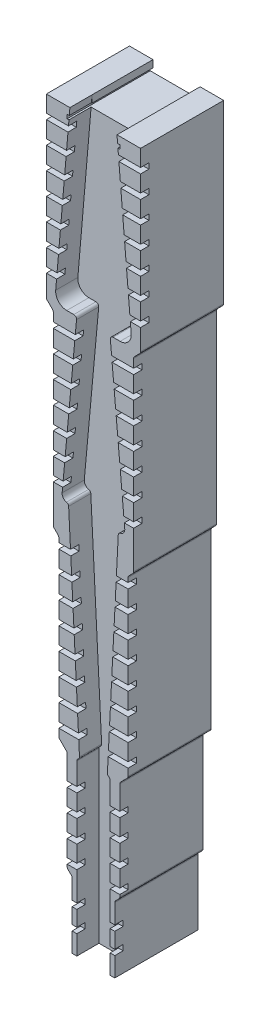
from build123d import *

# Parameters (mm, degrees)
ESQUISSE1_W             = 17
ESQUISSE1_H             = 132
BOSS_EXTRU_1_DEPTH      = 15
ENL_V_MAT_EXTRU_1_DEPTH = 4
CONG_1_R                = 2
CONG_2_R                = 0.5
CONG_3_R                = 1
CONG_4_R                = 0.5
CONG_6_R                = 0.5
CONG_7_R                = 0.5
ENL_V_MAT_EXTRU_2_REACH = 70.215
CONG_8_R                = 0.5
CONG_1_OF_SYM_TRIE2_R   = 2
CONG_2_OF_SYM_TRIE2_R   = 0.5
CONG_3_OF_SYM_TRIE2_R   = 1
CONG_4_OF_SYM_TRIE2_R   = 0.5
CONG_6_OF_SYM_TRIE2_R   = 0.5
CONG_7_OF_SYM_TRIE2_R   = 0.5
CONG_8_OF_SYM_TRIE2_R   = 0.5
CONG_9_R                = 0.5
ESQUISSE5_W             = 0.85
ESQUISSE5_H             = 1
ESQUISSE5_W_2           = 1.75
ESQUISSE5_W_3           = 3.596153846
ESQUISSE5_W_4           = 3.391025641
ESQUISSE5_W_5           = 3.185897436
ESQUISSE5_W_6           = 2.980769231
ESQUISSE5_W_7           = 2.775641026
ESQUISSE5_W_8           = 2.570512821
ESQUISSE5_W_9           = 2.365384615
ESQUISSE5_W_10          = 2.16025641
ESQUISSE5_W_11          = 3.9921875
ESQUISSE5_W_12          = 3.6484375
ESQUISSE5_W_13          = 3.3046875
ESQUISSE5_W_14          = 2.9609375
ESQUISSE5_W_15          = 2.6171875
ESQUISSE5_W_16          = 2.2734375
ESQUISSE5_W_17          = 1.9296875
ESQUISSE5_W_18          = 3.975
ESQUISSE5_W_19          = 3.608333333
ESQUISSE5_W_20          = 3.241666667
ESQUISSE5_W_21          = 2.875
ESQUISSE5_W_22          = 2.508333333
ESQUISSE5_W_23          = 2.141666667
ESQUISSE5_W_24          = 1.775
ENL_V_MAT_EXTRU_3_DEPTH = 1.5
ENL_V_MAT_EXTRU_4_DEPTH = 69.214734597


with BuildPart() as part:
    # Esquisse1 → Boss.-Extru.1 (new body)
    with BuildSketch(Plane.XY):
        Rectangle(ESQUISSE1_W, ESQUISSE1_H)
    extrude(amount=BOSS_EXTRU_1_DEPTH)

    # Esquisse2 → Enlèv. mat.-Extru.1 (cut)
    with BuildSketch(Plane.XY.offset(15)):
        Polygon((0, -66), (0, 66), (4.25, 66), (7, 34), (3, 34), (5.75, 4), (4.5, 4), (2.5, -35), (3, -35), (3, -66), align=None)
    enl_v_mat_extru_1 = extrude(amount=-ENL_V_MAT_EXTRU_1_DEPTH, mode=Mode.SUBTRACT)

    # Congé1
    cong_1_edges = [part.edges().sort_by_distance(p)[0] for p in [
        (7, 34, 13),
    ]]
    fillet(cong_1_edges, radius=CONG_1_R)

    # Congé2
    cong_2_edges = [part.edges().sort_by_distance(p)[0] for p in [
        (3, 34, 13),
    ]]
    fillet(cong_2_edges, radius=CONG_2_R)

    # Congé3
    cong_3_edges = [part.edges().sort_by_distance(p)[0] for p in [
        (5.75, 4, 13),
    ]]
    fillet(cong_3_edges, radius=CONG_3_R)

    # Congé4
    cong_4_edges = [part.edges().sort_by_distance(p)[0] for p in [
        (4.5, 4, 13),
    ]]
    fillet(cong_4_edges, radius=CONG_4_R)

    # Congé6
    cong_6_edges = [part.edges().sort_by_distance(p)[0] for p in [
        (3, -35, 13),
    ]]
    fillet(cong_6_edges, radius=CONG_6_R - 0.0001)  # a hair under: the kernel refuses the full size

    # Congé7
    cong_7_edges = [part.edges().sort_by_distance(p)[0] for p in [
        (2.5, -35, 13),
    ]]
    fillet(cong_7_edges, radius=CONG_7_R)

    # Esquisse4 → Enlèv. mat.-Extru.2 (cut, up to next)
    with BuildSketch(Plane.XY.offset(15), mode=Mode.PRIVATE) as enl_v_mat_extru_2_sk1:
        Polygon((8.5, 34), (7.25, 32.75), (7.25, -1), (6.25, -2), (6.25, -33.5), (4.75, -35), (4.75, -53.1), (3.85, -54), (3.85, -66), (8.5, -66), align=None)
    enl_v_mat_extru_2_tool1 = extrude(enl_v_mat_extru_2_sk1.sketch, amount=-ENL_V_MAT_EXTRU_2_REACH, mode=Mode.PRIVATE) & part.part
    enl_v_mat_extru_2 = enl_v_mat_extru_2_tool1.solids().sort_by_distance((6.965516, -29.327077, 15))[0]
    add(enl_v_mat_extru_2, mode=Mode.SUBTRACT)

    # Congé8
    cong_8_edges = [part.edges().sort_by_distance(p)[0] for p in [
        (3.85, -54, 7.5),
        (4.75, -53.1, 7.5),
        (4.75, -35, 7.5),
        (6.25, -33.5, 7.5),
        (6.25, -2, 7.5),
        (7.25, -1, 7.5),
        (7.25, 32.75, 7.5),
    ]]
    fillet(cong_8_edges, radius=CONG_8_R)

    # Symétrie2: Enlèv. mat.-Extru.1, Enlèv. mat.-Extru.2 across plane
    add(enl_v_mat_extru_1.mirror(Plane(origin=(0, 0, 0), x_dir=(0, 0, 1), z_dir=(1, 0, 0))), mode=Mode.SUBTRACT)
    add(enl_v_mat_extru_2.mirror(Plane(origin=(0, 0, 0), x_dir=(0, 0, 1), z_dir=(1, 0, 0))), mode=Mode.SUBTRACT)

    # Congé1 of Symétrie2
    cong_1_of_sym_trie2_edges = [part.edges().sort_by_distance(p)[0] for p in [
        (-7, 34, 13),
    ]]
    fillet(cong_1_of_sym_trie2_edges, radius=CONG_1_OF_SYM_TRIE2_R)

    # Congé2 of Symétrie2
    cong_2_of_sym_trie2_edges = [part.edges().sort_by_distance(p)[0] for p in [
        (-3, 34, 13),
    ]]
    fillet(cong_2_of_sym_trie2_edges, radius=CONG_2_OF_SYM_TRIE2_R)

    # Congé3 of Symétrie2
    cong_3_of_sym_trie2_edges = [part.edges().sort_by_distance(p)[0] for p in [
        (-5.75, 4, 13),
    ]]
    fillet(cong_3_of_sym_trie2_edges, radius=CONG_3_OF_SYM_TRIE2_R)

    # Congé4 of Symétrie2
    cong_4_of_sym_trie2_edges = [part.edges().sort_by_distance(p)[0] for p in [
        (-4.5, 4, 13),
    ]]
    fillet(cong_4_of_sym_trie2_edges, radius=CONG_4_OF_SYM_TRIE2_R)

    # Congé6 of Symétrie2
    cong_6_of_sym_trie2_edges = [part.edges().sort_by_distance(p)[0] for p in [
        (-3, -35, 13),
    ]]
    fillet(cong_6_of_sym_trie2_edges, radius=CONG_6_OF_SYM_TRIE2_R - 0.0001)  # a hair under: the kernel refuses the full size

    # Congé7 of Symétrie2
    cong_7_of_sym_trie2_edges = [part.edges().sort_by_distance(p)[0] for p in [
        (-2.5, -35, 13),
    ]]
    fillet(cong_7_of_sym_trie2_edges, radius=CONG_7_OF_SYM_TRIE2_R)

    # Congé8 of Symétrie2
    cong_8_of_sym_trie2_edges = [part.edges().sort_by_distance(p)[0] for p in [
        (-3.85, -54, 7.5),
        (-4.75, -53.1, 7.5),
        (-4.75, -35, 7.5),
        (-6.25, -33.5, 7.5),
        (-6.25, -2, 7.5),
        (-7.25, -1, 7.5),
        (-7.25, 32.75, 7.5),
    ]]
    fillet(cong_8_of_sym_trie2_edges, radius=CONG_8_OF_SYM_TRIE2_R)

    # Congé9
    cong_9_edges = [part.edges().sort_by_distance(p)[0] for p in [
        (-8.5, 34, 7.5),
        (8.5, 34, 7.5),
    ]]
    fillet(cong_9_edges, radius=CONG_9_R)

    # Esquisse5 → Enlèv. mat.-Extru.3 (cut)
    with BuildSketch(Plane.XY.offset(15)):
        with Locations((3.425, -62)):
            Rectangle(ESQUISSE5_W, ESQUISSE5_H)
        with Locations((3.425, -58.2)):
            Rectangle(ESQUISSE5_W, ESQUISSE5_H)
        with Locations((3.875, -52)):
            Rectangle(ESQUISSE5_W_2, ESQUISSE5_H)
        with Locations((3.875, -48)):
            Rectangle(ESQUISSE5_W_2, ESQUISSE5_H)
        with Locations((3.875, -44)):
            Rectangle(ESQUISSE5_W_2, ESQUISSE5_H)
        with Locations((3.875, -40)):
            Rectangle(ESQUISSE5_W_2, ESQUISSE5_H)
        with Locations((4.451923077, -31.5)):
            Rectangle(ESQUISSE5_W_3, ESQUISSE5_H)
        with Locations((4.55448718, -27.5)):
            Rectangle(ESQUISSE5_W_4, ESQUISSE5_H)
        with Locations((4.657051282, -23.5)):
            Rectangle(ESQUISSE5_W_5, ESQUISSE5_H)
        with Locations((4.759615384, -19.5)):
            Rectangle(ESQUISSE5_W_6, ESQUISSE5_H)
        with Locations((4.862179487, -15.5)):
            Rectangle(ESQUISSE5_W_7, ESQUISSE5_H)
        with Locations((4.96474359, -11.5)):
            Rectangle(ESQUISSE5_W_8, ESQUISSE5_H)
        with Locations((5.067307693, -7.5)):
            Rectangle(ESQUISSE5_W_9, ESQUISSE5_H)
        with Locations((5.169871795, -3.5)):
            Rectangle(ESQUISSE5_W_10, ESQUISSE5_H)
        with Locations((6.50390625, 62.5)):
            Rectangle(ESQUISSE5_W_11, ESQUISSE5_H)
        with Locations((6.67578125, 58.5)):
            Rectangle(ESQUISSE5_W_12, ESQUISSE5_H)
        with Locations((6.84765625, 54.5)):
            Rectangle(ESQUISSE5_W_13, ESQUISSE5_H)
        with Locations((7.01953125, 50.5)):
            Rectangle(ESQUISSE5_W_14, ESQUISSE5_H)
        with Locations((7.19140625, 46.5)):
            Rectangle(ESQUISSE5_W_15, ESQUISSE5_H)
        with Locations((7.36328125, 42.5)):
            Rectangle(ESQUISSE5_W_16, ESQUISSE5_H)
        with Locations((7.53515625, 38.5)):
            Rectangle(ESQUISSE5_W_17, ESQUISSE5_H)
        with Locations((5.2625, 30.5)):
            Rectangle(ESQUISSE5_W_18, ESQUISSE5_H)
        with Locations((5.445833334, 26.5)):
            Rectangle(ESQUISSE5_W_19, ESQUISSE5_H)
        with Locations((5.629166667, 22.5)):
            Rectangle(ESQUISSE5_W_20, ESQUISSE5_H)
        with Locations((5.8125, 18.5)):
            Rectangle(ESQUISSE5_W_21, ESQUISSE5_H)
        with Locations((5.995833334, 14.5)):
            Rectangle(ESQUISSE5_W_22, ESQUISSE5_H)
        with Locations((6.179166667, 10.5)):
            Rectangle(ESQUISSE5_W_23, ESQUISSE5_H)
        with Locations((6.3625, 6.5)):
            Rectangle(ESQUISSE5_W_24, ESQUISSE5_H)
    enl_v_mat_extru_3 = extrude(amount=-ENL_V_MAT_EXTRU_3_DEPTH, mode=Mode.SUBTRACT)

    # Symétrie3: Enlèv. mat.-Extru.3 across plane
    add(enl_v_mat_extru_3.mirror(Plane(origin=(0, 0, 0), x_dir=(0, 0, 1), z_dir=(1, 0, 0))), mode=Mode.SUBTRACT)

    # Esquisse6 → Enlèv. mat.-Extru.4 (cut, through all)
    with BuildSketch(Plane(origin=(0, 0, 0), x_dir=(-1, 0, 0), z_dir=(0, 0, -1))):
        Polygon((-4.25, 66), (-4.25, 64.7), (-4.75, 64.7), (-4.75, 64), (4.75, 64), (4.75, 64.7), (4.25, 64.7), (4.25, 66), align=None)
    extrude(amount=-ENL_V_MAT_EXTRU_4_DEPTH, mode=Mode.SUBTRACT)


solid = part.part
